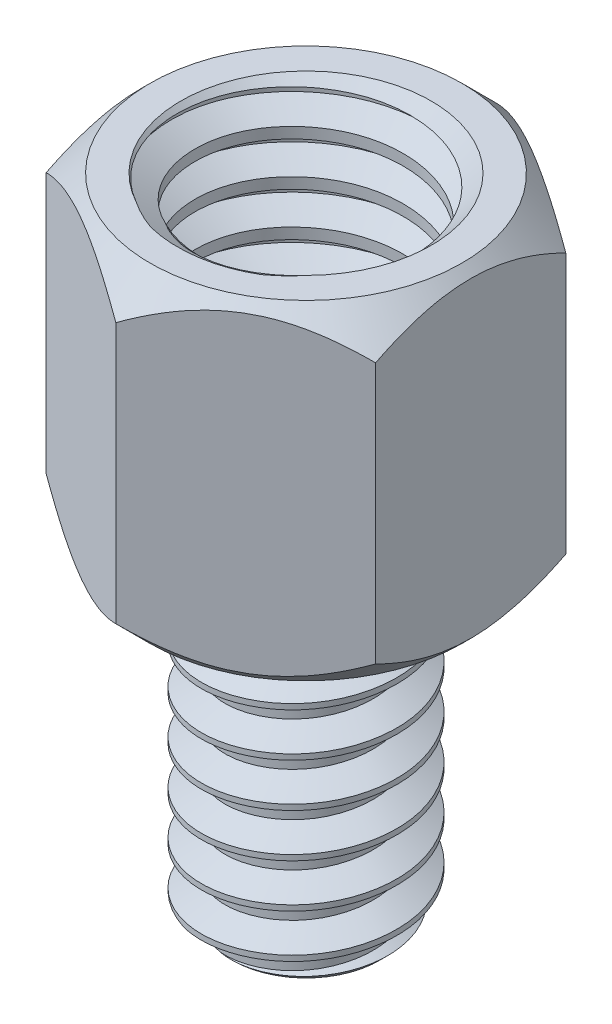
from build123d import *

# Parameters (mm, degrees)
EXTRUDE_1_DEPTH      = 4.8
THREAD_1_PITCH       = 0.635
HOLE_WIZARD_42_D     = 3.048
HOLE_WIZARD_42_DEPTH = 3.5
HOLE_WIZARD_42_TIP   = 0.915711583
CHAMFER_1_SIZE       = 0.3
THREAD_2_PITCH       = 0.635


with BuildPart() as part:
    # Sketch 1 → Бобышка-Вытянуть1 (new body)
    with BuildSketch(Plane(origin=(0, 0, 0), x_dir=(1, 0, 0), z_dir=(0, 1, 0))):
        Polygon((-2.4, 1.385640646), (-2.4, -1.385640646), (0, -2.771281292), (2.4, -1.385640646), (2.4, 1.385640646), (0, 2.771281292), align=None)
    extrude(amount=EXTRUDE_1_DEPTH)

    # Sketch 2 → Повернуть2 (revolve)
    with BuildSketch(Plane(origin=(0, 0, 0), x_dir=(0, 0, -1), z_dir=(1, 0, 0)), mode=Mode.PRIVATE) as revolve_2_sk:
        Polygon((0, 0), (0, -4.6), (1.07, -4.6), (1.4224, -4.2476), (1.4224, -0.664326819), (1.07, -0.5), (1.07, 0), align=None)
    revolve(revolve_2_sk.sketch.rotate(Axis((0, 0, 0), (0, -1, 0)), 180), axis=Axis((0, 0, 0), (0, -1, 0)))

    # Эскиз3 → Вырез-Повернуть1 (revolve, cut)
    with BuildSketch(Plane(origin=(0, 0, 0), x_dir=(0, 0, -1), z_dir=(1, 0, 0))):
        Polygon((-2.771281292, 4.8), (-2.771281292, 4.3), (-2.271281292, 4.8), align=None)
        Polygon((-2.771281292, 0), (-2.771281292, 0.5), (-2.271281292, 0), align=None)
    revolve(axis=Axis((0, 0, 0), (0, 1, 0)), mode=Mode.SUBTRACT)

    # Резьба1: the profile of Sketch 1 2 profile screwed along a right-hand helix of 7.244094 turns, 6 arcs to a turn; built about Z, then put on its axis
    thread_1_z = Axis((0, 0, 0), (0, 0, 1))
    thread_1_corners = [(1.4227, 0, -0.000173205), (1.4227, 0, 0.555798203), (1.078696169, 0, 0.357187499), (1.078696169, 0, 0.198437499)]
    with BuildLine(mode=Mode.PRIVATE) as thread_1_profile:
        Line(thread_1_corners[0], thread_1_corners[1])
        Line(thread_1_corners[1], thread_1_corners[2])
        Line(thread_1_corners[2], thread_1_corners[3])
        Line(thread_1_corners[3], thread_1_corners[0])
    thread_1_cap = Face(thread_1_profile.wire())
    thread_1_turn_angles = [0, 30, 60, 90, 120, 150, 180, 210, 240, 270, 300, 330, 360]
    thread_1_turn_weights = [1, 0.8660254037844387, 1, 0.8660254037844387, 1, 0.8660254037844387, 1, 0.8660254037844387, 1, 0.8660254037844387, 1, 0.8660254037844387, 1]
    thread_1_turn_rails = [Edge.make_bspline([Vector(p[0], p[1], 0).rotate(thread_1_z, thread_1_turn_angles[k]) / thread_1_turn_weights[k] + Vector(0, 0, p[2] + THREAD_1_PITCH * thread_1_turn_angles[k] / 360) for k in range(13)], [0, 0, 0, 1, 1, 2, 2, 3, 3, 4, 4, 5, 5, 6, 6, 6], 2, thread_1_turn_weights) for p in thread_1_corners]
    thread_1_turn_sides = [Face.make_surface_from_curves(thread_1_turn_rails[p[0]], thread_1_turn_rails[p[1]]) for p in [(0, 1), (1, 2), (2, 3), (3, 0)]]
    thread_1_last_angles = [2520, 2550, 2580, 2593.937007874, 2607.874015748]
    thread_1_last_weights = [1, 0.8660254037844387, 1, 0.9705611135832087, 1]
    thread_1_last_rails = [Edge.make_bspline([Vector(p[0], p[1], 0).rotate(thread_1_z, thread_1_last_angles[k]) / thread_1_last_weights[k] + Vector(0, 0, p[2] + THREAD_1_PITCH * thread_1_last_angles[k] / 360) for k in range(5)], [0, 0, 0, 1, 1, 2, 2, 2], 2, thread_1_last_weights) for p in thread_1_corners]
    thread_1_last_sides = [Face.make_surface_from_curves(thread_1_last_rails[p[0]], thread_1_last_rails[p[1]]) for p in [(0, 1), (1, 2), (2, 3), (3, 0)]]
    thread_1 = Plane(origin=(0, -5.2476, 0), x_dir=(1, 0, 0), z_dir=(0, 1, 0)) * Solid(Shell([*[p.moved(Location((0, 0, THREAD_1_PITCH * i))) for i in range(7) for p in thread_1_turn_sides], *thread_1_last_sides, thread_1_cap, thread_1_cap.rotate(thread_1_z, 2607.874015748).moved(Location((0, 0, THREAD_1_PITCH * 2607.874015748 / 360)))]))
    add(thread_1, mode=Mode.SUBTRACT)

    # Сверло под метчик  спиральное #42
    with Locations(Plane.ZX.offset(4.8)):
        with Locations((0, 0)):
            Hole(HOLE_WIZARD_42_D / 2, depth=HOLE_WIZARD_42_DEPTH)
            with Locations((0, 0, -(HOLE_WIZARD_42_DEPTH + HOLE_WIZARD_42_TIP / 2))):  # 118° drill point
                Cone(0, HOLE_WIZARD_42_D / 2, HOLE_WIZARD_42_TIP, mode=Mode.SUBTRACT)

    # Фаска1
    chamfer_1_edges = [part.edges().sort_by_distance(p)[0] for p in [
        (0, 4.8, 1.524),
    ]]
    chamfer(chamfer_1_edges, length=CHAMFER_1_SIZE)

    # Резьба2: the profile of Sketch 2 2 profile screwed along a right-hand helix of 6.299213 turns, 6 arcs to a turn; built about Z, then put on its axis
    thread_2_z = Axis((0, 0, 0), (0, 0, 1))
    thread_2_corners = [(1.5237, 0, -0.000173205), (1.867703831, 0, 0.198437499), (1.867703831, 0, 0.277812499), (1.5237, 0, 0.476423203)]
    with BuildLine(mode=Mode.PRIVATE) as thread_2_profile:
        Line(thread_2_corners[0], thread_2_corners[1])
        Line(thread_2_corners[1], thread_2_corners[2])
        Line(thread_2_corners[2], thread_2_corners[3])
        Line(thread_2_corners[3], thread_2_corners[0])
    thread_2_cap = Face(thread_2_profile.wire())
    thread_2_turn_angles = [0, 30, 60, 90, 120, 150, 180, 210, 240, 270, 300, 330, 360]
    thread_2_turn_weights = [1, 0.8660254037844387, 1, 0.8660254037844387, 1, 0.8660254037844387, 1, 0.8660254037844387, 1, 0.8660254037844387, 1, 0.8660254037844387, 1]
    thread_2_turn_rails = [Edge.make_bspline([Vector(p[0], p[1], 0).rotate(thread_2_z, thread_2_turn_angles[k]) / thread_2_turn_weights[k] + Vector(0, 0, p[2] + THREAD_2_PITCH * thread_2_turn_angles[k] / 360) for k in range(13)], [0, 0, 0, 1, 1, 2, 2, 3, 3, 4, 4, 5, 5, 6, 6, 6], 2, thread_2_turn_weights) for p in thread_2_corners]
    thread_2_turn_sides = [Face.make_surface_from_curves(thread_2_turn_rails[p[0]], thread_2_turn_rails[p[1]]) for p in [(0, 1), (1, 2), (2, 3), (3, 0)]]
    thread_2_last_angles = [2160, 2190, 2220, 2243.858267717, 2267.716535433]
    thread_2_last_weights = [1, 0.8660254037844387, 1, 0.9145488039507501, 1]
    thread_2_last_rails = [Edge.make_bspline([Vector(p[0], p[1], 0).rotate(thread_2_z, thread_2_last_angles[k]) / thread_2_last_weights[k] + Vector(0, 0, p[2] + THREAD_2_PITCH * thread_2_last_angles[k] / 360) for k in range(5)], [0, 0, 0, 1, 1, 2, 2, 2], 2, thread_2_last_weights) for p in thread_2_corners]
    thread_2_last_sides = [Face.make_surface_from_curves(thread_2_last_rails[p[0]], thread_2_last_rails[p[1]]) for p in [(0, 1), (1, 2), (2, 3), (3, 0)]]
    thread_2 = Plane(origin=(0, 5.5, 0), x_dir=(-1, 0, 0), z_dir=(0, -1, 0)) * Solid(Shell([*[p.moved(Location((0, 0, THREAD_2_PITCH * i))) for i in range(6) for p in thread_2_turn_sides], *thread_2_last_sides, thread_2_cap, thread_2_cap.rotate(thread_2_z, 2267.716535433).moved(Location((0, 0, THREAD_2_PITCH * 2267.716535433 / 360)))]))
    add(thread_2, mode=Mode.SUBTRACT)


solid = part.part
